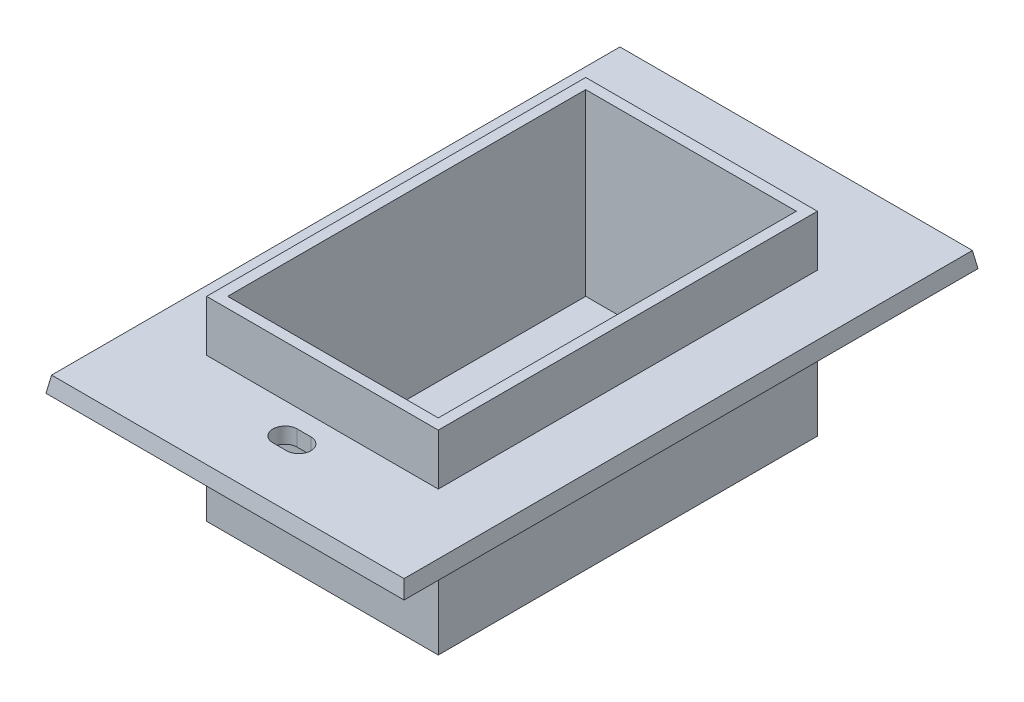
from build123d import *

# Parameters (mm, degrees)
SKETCH1_W           = 44
SKETCH1_H           = 72
BOSS_EXTRUDE1_DEPTH = 3
SKETCH2_W           = 44
SKETCH2_H           = 72
SKETCH2_W_2         = 40
SKETCH2_H_2         = 68
BOSS_EXTRUDE2_DEPTH = 34
SKETCH3_W           = 68
SKETCH3_H           = 109
SKETCH3_W_2         = 44
SKETCH3_H_2         = 72
BOSS_EXTRUDE3_DEPTH = 3
CHAMFER1_SIZE       = 0.528980942
CHAMFER1_SIZE_2     = 3


with BuildPart() as part:
    # Sketch1 → Boss-Extrude1 (new body)
    with BuildSketch(Plane(origin=(0, 0, 0), x_dir=(1, 0, 0), z_dir=(0, 1, 0))):
        with Locations((22, 36)):
            Rectangle(SKETCH1_W, SKETCH1_H)
    extrude(amount=BOSS_EXTRUDE1_DEPTH)

    # Sketch2 → Boss-Extrude2 (add)
    with BuildSketch(Plane(origin=(0, 3, 0), x_dir=(1, 0, 0), z_dir=(0, 1, 0))):
        with Locations((22, 36)):
            Rectangle(SKETCH2_W, SKETCH2_H)
        with Locations((22, 36)):
            Rectangle(SKETCH2_W_2, SKETCH2_H_2, mode=Mode.SUBTRACT)
    extrude(amount=BOSS_EXTRUDE2_DEPTH)

    # Sketch3 → Boss-Extrude3 (add)
    with BuildSketch(Plane(origin=(0, 24.3, 0), x_dir=(1, 0, 0), z_dir=(0, 1, 0))):
        with Locations((22, 36)):
            Rectangle(SKETCH3_W, SKETCH3_H)
        with Locations((22, 36)):
            Rectangle(SKETCH3_W_2, SKETCH3_H_2, mode=Mode.SUBTRACT)
        with BuildLine():
            Line((20.7, -3.5), (23.3, -3.5))
            ThreePointArc((23.3, -3.5), (25.6, -5.8), (23.3, -8.1))
            Line((23.3, -8.1), (20.7, -8.1))
            ThreePointArc((20.7, -8.1), (18.4, -5.8), (20.7, -3.5))
        make_face(mode=Mode.SUBTRACT)
        with BuildLine():
            Line((20.7, 75.5), (23.3, 75.5))
            ThreePointArc((23.3, 75.5), (25.6, 77.8), (23.3, 80.1))
            Line((23.3, 80.1), (20.7, 80.1))
            ThreePointArc((20.7, 80.1), (18.4, 77.8), (20.7, 75.5))
        make_face(mode=Mode.SUBTRACT)
    extrude(amount=BOSS_EXTRUDE3_DEPTH)

    # Chamfer1
    # the kernel refuses this chamfer: 3, 0.528980942 mm, written as the material it takes off along each edge
    with BuildSketch(Plane(origin=(-19.795616389, 27.3, -90.5), x_dir=(0, 0.21013876076743068, 0.9776715712462589), z_dir=(1, 0, 0)), Plane(origin=(63.795616389, 27.3, 18.5), x_dir=(0, 0.21013876076743068, -0.9776715712462589), z_dir=(-1, 0, 0))) as chamfer1_piece_1:
        Polygon((CHAMFER1_SIZE * 0.977671571478, CHAMFER1_SIZE * 0.210138760817), (-CHAMFER1_SIZE_2 * 0.210138760767, CHAMFER1_SIZE_2 * 0.977671571246), (0, 0), align=None)
    extrude(amount=83.591232779, mode=Mode.SUBTRACT)
    with BuildSketch(Plane(origin=(-12, 27.3, 26.295616389), x_dir=(0.9776715712462593, 0.21013876076742874, 0), z_dir=(0, 0, -1)), Plane(origin=(56, 27.3, -98.295616389), x_dir=(-0.9776715712462594, 0.21013876076742807, 0), z_dir=(0, 0, 1))) as chamfer1_piece_2:
        Polygon((CHAMFER1_SIZE * 0.977671571478, CHAMFER1_SIZE * 0.210138760817), (-CHAMFER1_SIZE_2 * 0.210138760767, CHAMFER1_SIZE_2 * 0.977671571246), (0, 0), align=None)
    extrude(amount=124.591232779, mode=Mode.SUBTRACT)


solid = part.part
